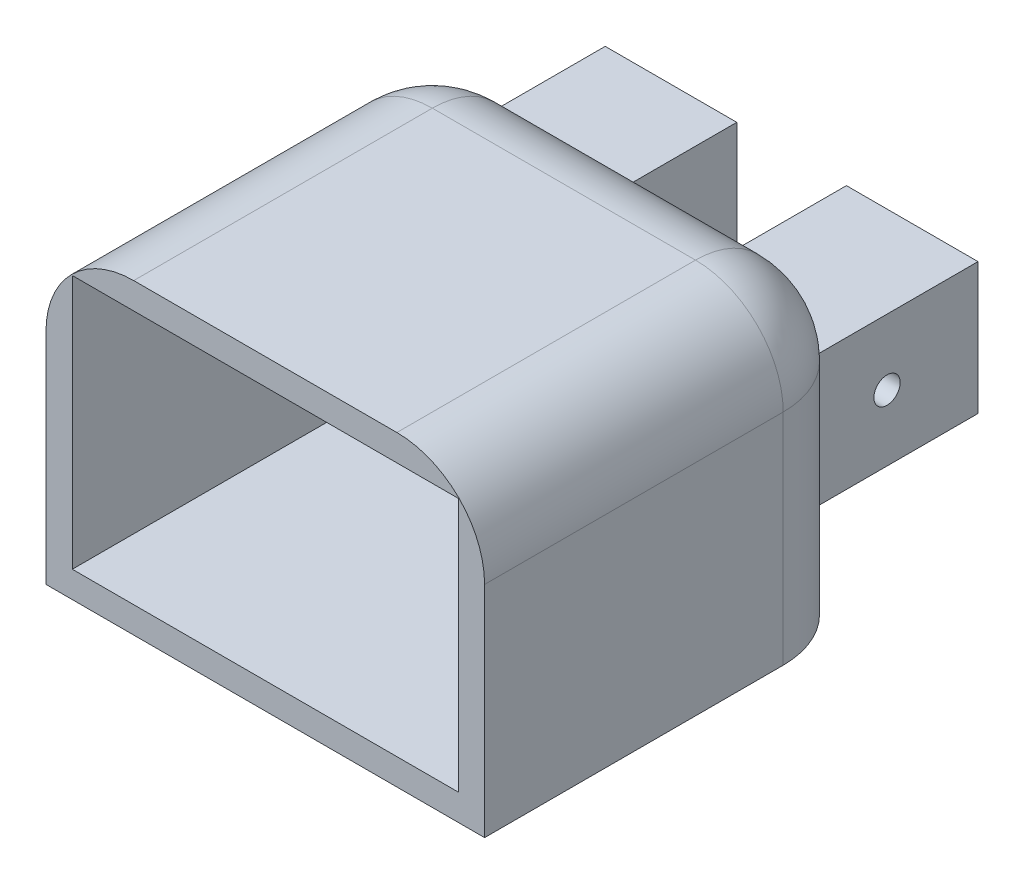
from build123d import *

# Parameters (mm, degrees)
SKETCH1_W           = 50
SKETCH1_H           = 60
BOSS_EXTRUDE1_DEPTH = 35
SKETCH2_W           = 44
SKETCH2_H           = 29
CUT_EXTRUDE1_DEPTH  = 30
CUT_EXTRUDE2_DEPTH  = 36
SKETCH5_R           = 1.5
CUT_EXTRUDE3_DEPTH  = 48
CUT_EXTRUDE5_DEPTH  = 50.17
FILLET1_R           = 10
FILLET2_START       = -24.274933135
FILLET2_OUTLINE_W   = 50
FILLET2_OUTLINE_H   = 35
FILLET2_DEPTH       = 10
FILLET2_START_2     = -15.881773092
FILLET2_2_DEPTH     = 35.650922027
FILLET2_3_DEPTH     = 25
FILLET2_START_3     = 10
FILLET2_4_DEPTH     = 15
FILLET2_5_ANGLE     = 90


with BuildPart() as part:
    # Sketch1 → Boss-Extrude1 (new body)
    with BuildSketch(Plane(origin=(0, 0, 0), x_dir=(1, 0, 0), z_dir=(0, 1, 0))):
        with Locations((0, 10.230851065)):
            Rectangle(SKETCH1_W, SKETCH1_H)
    extrude(amount=BOSS_EXTRUDE1_DEPTH)

    # Sketch2 → Cut-Extrude1 (cut)
    with BuildSketch(Plane.XY.offset(19.769148935)):
        with Locations((0, 17.5)):
            Rectangle(SKETCH2_W, SKETCH2_H)
    extrude(amount=-CUT_EXTRUDE1_DEPTH, mode=Mode.SUBTRACT)

    # Sketch4 → Cut-Extrude2 (cut)
    with BuildSketch(Plane(origin=(0, 0, 0), x_dir=(-1, 0, 0), z_dir=(0, -1, 0))):
        Polygon((-25, 24.274933135), (-21.25, 24.274933135), (-21.25, 40.230851065), (-6.25, 40.230851065), (-6.25, 24.274933135), (6.25, 24.274933135), (6.25, 40.230851065), (21.25, 40.230851065), (21.25, 24.274933135), (25, 24.274933135), (38.228638219, 24.274933135), (38.228638219, 61.695696762), (-27.361816785, 61.695696762), (-27.361816785, 24.274933135), align=None)
    extrude(amount=-CUT_EXTRUDE2_DEPTH, mode=Mode.SUBTRACT)

    # Sketch5 → Cut-Extrude3 (cut)
    with BuildSketch(Plane(origin=(21.25, 0, 0), x_dir=(0, 0, -1), z_dir=(1, 0, 0))):
        with Locations((29.859024855, 17.5)):
            Circle(SKETCH5_R)
    extrude(amount=-CUT_EXTRUDE3_DEPTH, mode=Mode.SUBTRACT)

    # Sketch12 → Cut-Extrude5 (cut)
    with BuildSketch(Plane.ZY.offset(21.25)):
        Polygon((-40.230851065, 10), (-24.274933135, 10), (-24.274933135, -4.872452702), (-41.905821838, -4.872452702), (-41.905821838, 36.918280203), (-24.274933135, 36.918280203), (-24.274933135, 25), (-40.230851065, 25), align=None)
    extrude(amount=-CUT_EXTRUDE5_DEPTH, mode=Mode.SUBTRACT)

    # Fillet1
    fillet1_edges = [part.edges().sort_by_distance(p)[0] for p in [
        (0, 35, -24.274933135),
    ]]
    fillet(fillet1_edges, radius=FILLET1_R - 0.0001)  # a hair under: the kernel refuses the full size

    # Fillet2: read off the stored shape, not the designer's step
    # Fillet2 outline → Fillet2 (cut)
    with BuildSketch(Plane.XY.offset(FILLET2_START)):
        with Locations((0, 17.5)):
            Rectangle(FILLET2_OUTLINE_W, FILLET2_OUTLINE_H)
    extrude(amount=FILLET2_DEPTH, mode=Mode.SUBTRACT)

    # Fillet2 2 outline → Fillet2 2 (cut)
    with BuildSketch(Plane.XY.offset(FILLET2_START_2)):
        with BuildLine():
            Line((25, 35), (15, 35))
            ThreePointArc((15, 35), (22.071067812, 32.071067812), (25, 25))
            Line((25, 25), (25, 35))
        make_face()
        with BuildLine():
            ThreePointArc((-25, 25), (-22.071067812, 32.071067812), (-15, 35))
            Line((-15, 35), (-25, 35))
            Line((-25, 35), (-25, 25))
        make_face()
    extrude(amount=FILLET2_2_DEPTH, mode=Mode.SUBTRACT)

    # Fillet2 3 outline → Fillet2 3 (add)
    with BuildSketch(Plane(origin=(0, 0, 0), x_dir=(1, 0, 0), z_dir=(0, 1, 0))):
        with BuildLine():
            ThreePointArc((-15, 24.274933135), (-22.071067812, 21.346000947), (-25, 14.274933135))
            Line((-25, 14.274933135), (25, 14.274933135))
            ThreePointArc((25, 14.274933135), (22.071067812, 21.346000947), (15, 24.274933135))
            Line((15, 24.274933135), (-15, 24.274933135))
        make_face()
    extrude(amount=FILLET2_3_DEPTH)

    # Fillet2 4 outline → Fillet2 4 (add)
    with BuildSketch(Plane(origin=(0, 0, 0), x_dir=(1, 0, 0), z_dir=(0, 1, 0)).offset(FILLET2_START_3)):
        with BuildLine():
            Line((-21.25, 24.274933135), (-21.25, 22.081180633))
            ThreePointArc((-21.25, 22.081180633), (-18.311912214, 23.710569706), (-15, 24.274933135))
            Line((-15, 24.274933135), (-21.25, 24.274933135))
        make_face()
        with BuildLine():
            ThreePointArc((15, 24.274933135), (18.311912214, 23.710569706), (21.25, 22.081180633))
            Line((21.25, 22.081180633), (21.25, 24.274933135))
            Line((21.25, 24.274933135), (15, 24.274933135))
        make_face()
    extrude(amount=FILLET2_4_DEPTH)

    # Fillet2 5 outline → Fillet2 5 (revolve)
    with BuildSketch(Plane(origin=(0, 25, -14.274933135), x_dir=(0, 0, -1), z_dir=(0, -1, 0))):
        with BuildLine():
            Line((10, -15), (10, 15))
            ThreePointArc((10, 15), (7.071067812, 22.071067812), (0, 25))
            Line((0, 25), (0, -25))
            ThreePointArc((0, -25), (7.071067812, -22.071067812), (10, -15))
        make_face()
    revolve(axis=Axis((0, 25, -14.274933135), (1, 0, 0)), revolution_arc=FILLET2_5_ANGLE)


solid = part.part
